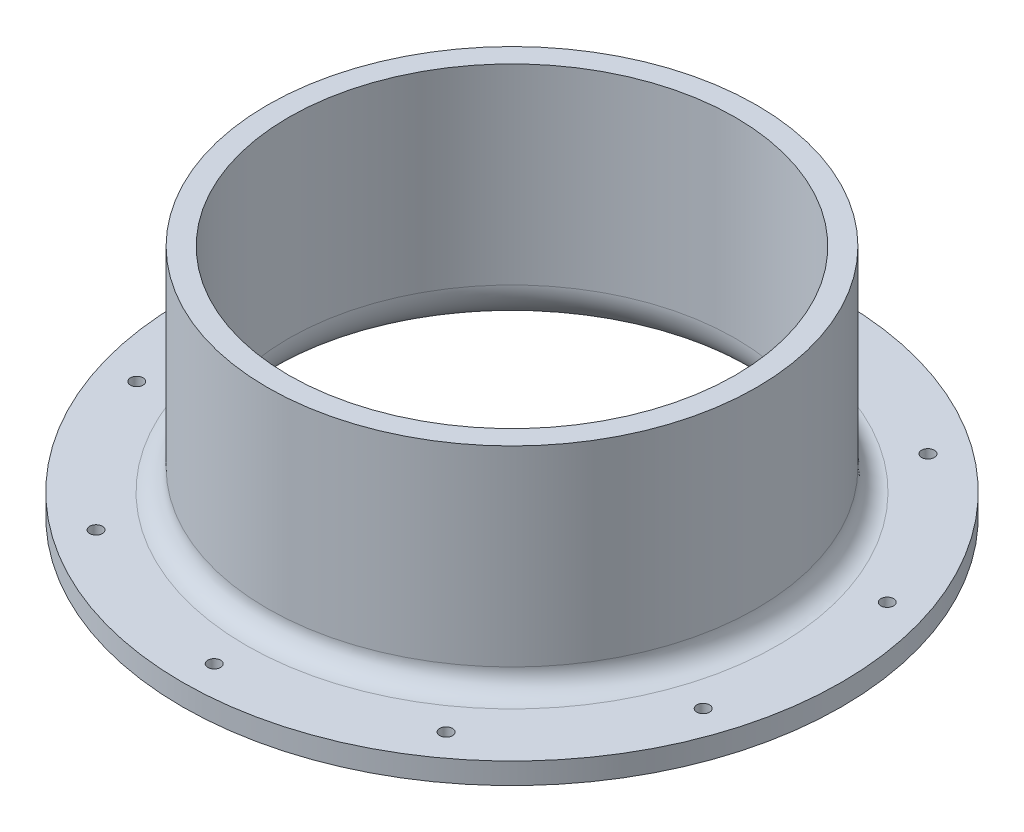
from build123d import *

# Parameters (mm, degrees)
SKETCH2_R                    = 98.425
SKETCH2_R_2                  = 66.675
BOSS_EXTRUDE1_DEPTH          = 6.35
BOSS_EXTRUDE2_START          = 63.5
SKETCH2_3_R                  = 73.025
SKETCH2_3_R_2                = 66.675
BOSS_EXTRUDE2_DEPTH          = 63.5
FILLET1_R                    = 6.35
FILLET2_R                    = 12.7
SKETCH2_5_R                  = 1.9
CUT_EXTRUDE2_DEPTH           = 153.9941543
CHAMFER2_SIZE                = 1.524
CIRPATTERN1_COUNT            = 10
CHAMFER2_OF_CIRPATTERN1_SIZE = 1.524


with BuildPart() as part:
    # Sketch2 → Boss-Extrude1 (new body)
    with BuildSketch(Plane(origin=(0, 0, 0), x_dir=(1, 0, 0), z_dir=(0, 1, 0))):
        Circle(SKETCH2_R)
        Circle(SKETCH2_R_2, mode=Mode.SUBTRACT)
    extrude(amount=-BOSS_EXTRUDE1_DEPTH)

    # Sketch2<3> → Boss-Extrude2 (add)
    with BuildSketch(Plane(origin=(0, 0, 0), x_dir=(1, 0, 0), z_dir=(0, 1, 0)).offset(BOSS_EXTRUDE2_START)):
        Circle(SKETCH2_3_R)
        Circle(SKETCH2_3_R_2, mode=Mode.SUBTRACT)
    extrude(amount=-BOSS_EXTRUDE2_DEPTH)

    # Fillet1
    fillet1_edges = [part.edges().sort_by_distance(p)[0] for p in [
        (-73.025, 0, 0),
    ]]
    fillet(fillet1_edges, radius=FILLET1_R)

    # Fillet2
    fillet2_edges = [part.edges().sort_by_distance(p)[0] for p in [
        (-66.675, -6.35, 0),
    ]]
    fillet(fillet2_edges, radius=FILLET2_R)

    # Sketch2<5> → Cut-Extrude2 (cut, through all)
    with BuildSketch(Plane(origin=(0, 0, 0), x_dir=(1, 0, 0), z_dir=(0, 1, 0))):
        with Locations((0, 88.9)):
            Circle(SKETCH2_5_R)
    cut_extrude2 = extrude(amount=-CUT_EXTRUDE2_DEPTH, mode=Mode.SUBTRACT)

    # Chamfer2
    chamfer2_edges = [part.edges().sort_by_distance(p)[0] for p in [
        (-1.9, -6.35, -88.9),
    ]]
    chamfer(chamfer2_edges, length=CHAMFER2_SIZE)

    # CirPattern1: Cut-Extrude2 ×10 about axis
    cirpattern1_axis = Axis((0, 0, 0), (0, 1, 0))
    for i in range(1, CIRPATTERN1_COUNT):
        add(cut_extrude2.rotate(cirpattern1_axis, i * 360 / CIRPATTERN1_COUNT), mode=Mode.SUBTRACT)

    # Chamfer2 of CirPattern1
    chamfer2_of_cirpattern1_edges = [part.edges().sort_by_distance(p)[0] for p in [
        (-53.791241218, -6.35, -70.804818821),
        (-85.136056588, -6.35, -25.664603419),
        (-83.961792009, -6.35, 29.278618181),
        (-50.716976639, -6.35, 73.038402779),
        (1.9, -6.35, 88.9),
        (53.791241218, -6.35, 70.804818821),
        (85.136056588, -6.35, 25.664603419),
        (83.961792009, -6.35, -29.278618181),
        (50.716976639, -6.35, -73.038402779),
    ]]
    chamfer(chamfer2_of_cirpattern1_edges, length=CHAMFER2_OF_CIRPATTERN1_SIZE)


solid = part.part
